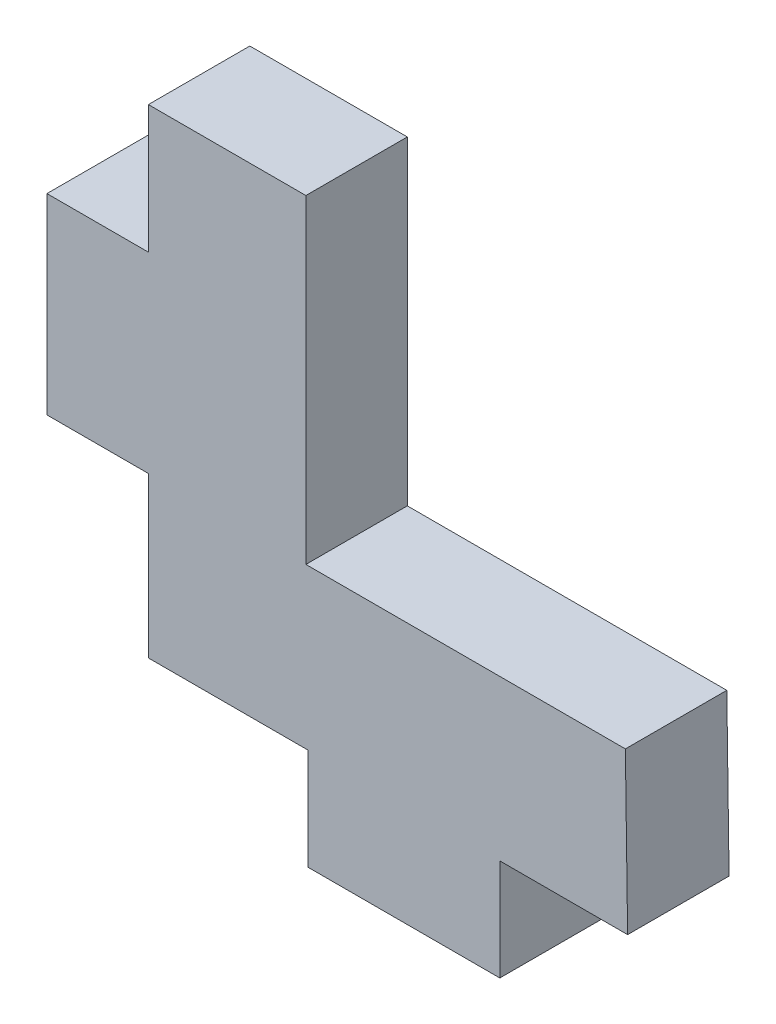
from build123d import *

# Parameters (mm, degrees)
BOSS_EXTRUDE1_DEPTH = 1.5875


with BuildPart() as part:
    # Sketch1 → Boss-Extrude1 (new, symmetric)
    with BuildSketch(Plane.XY):
        Polygon((0, 0), (0, 5), (-3.175, 5), (-3.175, 11), (0, 11), (0, 15), (4.929507644, 15), (4.929507644, 5), (14.929507644, 5), (15, 0), (11, 0), (11, -3.175), (5, -3.175), (5, 0), align=None)
    extrude(amount=BOSS_EXTRUDE1_DEPTH, both=True)


solid = part.part
